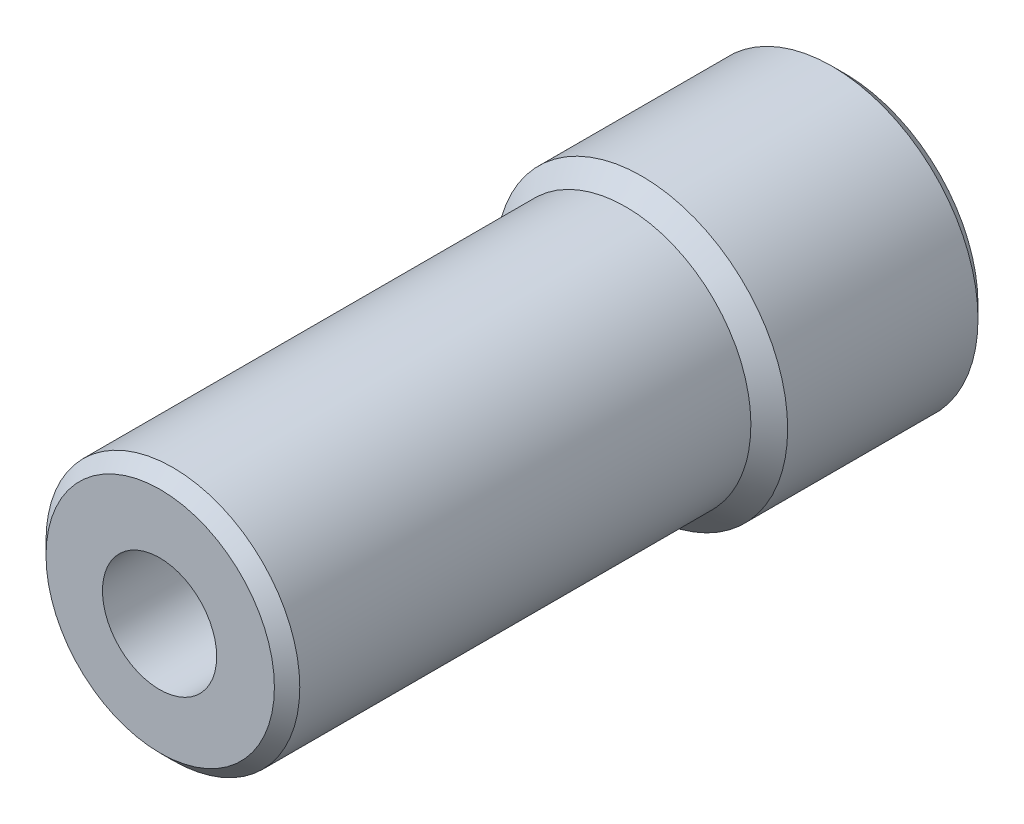
from build123d import *

# Parameters (mm, degrees)
SKETCH2_R           = 5.75
BOSS_EXTRUDE2_DEPTH = 10
SKETCH3_R           = 5
BOSS_EXTRUDE3_DEPTH = 17
SKETCH4_R           = 2.5
CUT_EXTRUDE1_DEPTH  = 10.7
SKETCH5_R           = 2.25
CUT_EXTRUDE2_DEPTH  = 17.7
CHAMFER4_SIZE       = 2
CHAMFER5_SIZE       = 0.5
CHAMFER6_SIZE       = 0.5


with BuildPart() as part:
    # Sketch2 → Boss-Extrude2 (new body)
    with BuildSketch(Plane.XY):
        with Locations((0, -0.068254458)):
            Circle(SKETCH2_R)
    extrude(amount=BOSS_EXTRUDE2_DEPTH)

    # Sketch3 → Boss-Extrude3 (add)
    with BuildSketch(Plane.XY.offset(10)):
        with Locations((0.02487522, 0)):
            Circle(SKETCH3_R)
    extrude(amount=BOSS_EXTRUDE3_DEPTH)

    # Sketch4 → Cut-Extrude1 (cut)
    with BuildSketch(Plane(origin=(0, 0, 0), x_dir=(-1, 0, 0), z_dir=(0, 0, -1))):
        Circle(SKETCH4_R)
    extrude(amount=-CUT_EXTRUDE1_DEPTH, mode=Mode.SUBTRACT)

    # Sketch5 → Cut-Extrude2 (cut)
    with BuildSketch(Plane.XY.offset(27)):
        with Locations((0, -0.093129678)):
            Circle(SKETCH5_R)
    extrude(amount=-CUT_EXTRUDE2_DEPTH, mode=Mode.SUBTRACT)

    # Chamfer4
    # the kernel refuses this chamfer: 2 mm, written as the material it takes off along each edge
    with BuildSketch(Plane(origin=(0, -0.068254458, 10), x_dir=(1, 0, 0), z_dir=(0, -1, 0))) as chamfer4_piece_1_section:
        Polygon((5.75, -CHAMFER4_SIZE), (5.75 - CHAMFER4_SIZE, 0), (5.75, 0), align=None)
    chamfer4_piece_1 = revolve(axis=Axis((0, -0.068254458, 10), (0, 0, 1)), mode=Mode.PRIVATE)
    chamfer4_piece_1 = chamfer4_piece_1 - Plane(origin=(0.02487522, 0, 8.408355985), x_dir=(1, 0, 0), z_dir=(0, 0, -1)) * Cylinder(5, 23, mode=Mode.PRIVATE)
    add(chamfer4_piece_1, mode=Mode.SUBTRACT)

    # Chamfer5
    chamfer5_edges = [part.edges().sort_by_distance(p)[0] for p in [
        (-4.97512478, 0, 27),
    ]]
    chamfer(chamfer5_edges, length=CHAMFER5_SIZE)

    # Chamfer6
    chamfer6_edges = [part.edges().sort_by_distance(p)[0] for p in [
        (-5.75, -0.068254458, 0),
    ]]
    chamfer(chamfer6_edges, length=CHAMFER6_SIZE)


solid = part.part
